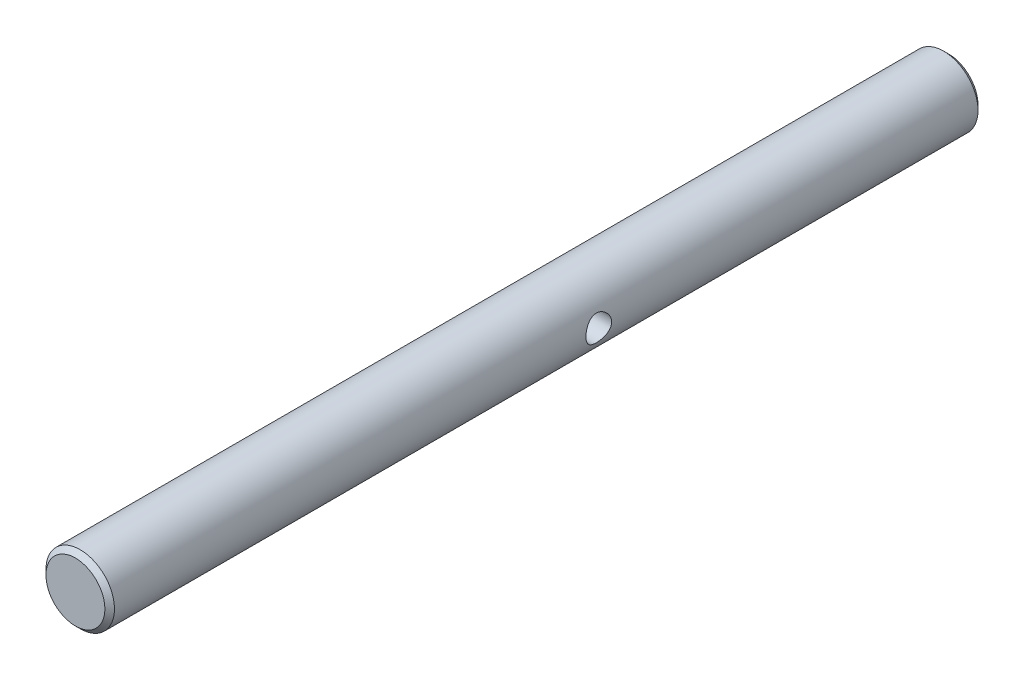
from build123d import *

# Parameters (mm, degrees)
BOSS_EXTRUDE1_DEPTH      = 50.9662557
BOSS_EXTRUDE1_DEPTH_BACK = 50.9662557
SKETCH1_R                = 4
CUT_EXTRUDE1_START       = -4.000000101
CUT_EXTRUDE1_OUTLINE_R   = 1.500000048
CUT_EXTRUDE1_DEPTH       = 8.000000202
CHAMFER1_SIZE            = 0.56


# Read off the part's stored shape, not the designer's step: Cut-Extrude1
with BuildPart() as part:
    # Sketch1 → Boss-Extrude1 (new, two sides: drawn at the far end of the back side and taken through both)
    with BuildSketch(Plane.XY.offset(-BOSS_EXTRUDE1_DEPTH_BACK)):
        Circle(SKETCH1_R)
    extrude(amount=BOSS_EXTRUDE1_DEPTH + BOSS_EXTRUDE1_DEPTH_BACK)

    # Cut-Extrude1 outline → Cut-Extrude1 (cut)
    with BuildSketch(Plane.YZ.offset(CUT_EXTRUDE1_START)):
        with Locations((0, -6.1352557)):
            Circle(CUT_EXTRUDE1_OUTLINE_R)
    extrude(amount=CUT_EXTRUDE1_DEPTH, mode=Mode.SUBTRACT)

    # Chamfer1
    chamfer1_edges = [part.edges().sort_by_distance(p)[0] for p in [
        (-4, 0, -50.9662557),
        (-4, 0, 50.9662557),
    ]]
    chamfer(chamfer1_edges, length=CHAMFER1_SIZE)


solid = part.part
